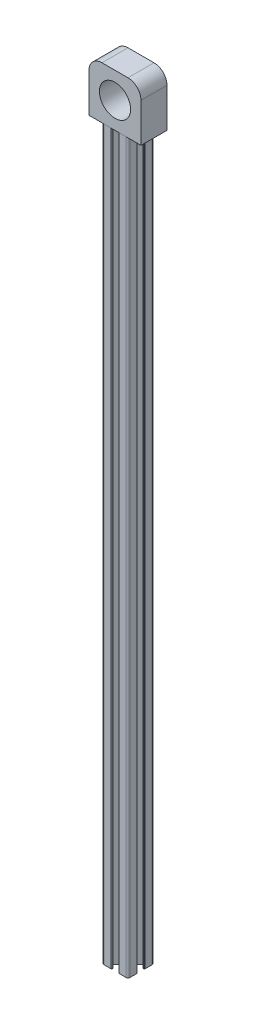
from build123d import *

# Parameters (mm, degrees)
BOSS_EXTRUDE1_DEPTH = 560
SKETCH2_W           = 40
SKETCH2_H           = 20
BOSS_EXTRUDE2_DEPTH = 40
FILLET1_R           = 10
SKETCH3_R           = 12
CUT_EXTRUDE1_DEPTH  = 40


with BuildPart() as part:
    # Sketch1 → Boss-Extrude1 (new body)
    with BuildSketch(Plane(origin=(0, 0, 0), x_dir=(1, 0, 0), z_dir=(0, 1, 0))):
        with BuildLine():
            Line((9.494919477, 2.658080263), (9.010919477, 2.658080263))
            ThreePointArc((9.010919477, 2.658080263), (8.651709233, 2.806870018), (8.502919477, 3.166080263))
            Line((8.502919477, 3.166080263), (8.502919477, 5.515080263))
            ThreePointArc((8.502919477, 5.515080263), (8.354129722, 5.874290508), (7.994919477, 6.023080263))
            Line((7.994919477, 6.023080263), (7.269000139, 6.023080263))
            ThreePointArc((7.269000139, 6.023080263), (7.074596955, 5.984411065), (6.909789894, 5.874290508))
            Line((6.909789894, 5.874290508), (3.806709233, 2.771209846))
            ThreePointArc((3.806709233, 2.771209846), (3.696588675, 2.606402785), (3.657919477, 2.411999602))
            Line((3.657919477, 2.411999602), (3.657919477, -2.355839076))
            ThreePointArc((3.657919477, -2.355839076), (3.696588675, -2.550242259), (3.806709233, -2.71504932))
            Line((3.806709233, -2.71504932), (6.909789894, -5.818129982))
            ThreePointArc((6.909789894, -5.818129982), (7.074596955, -5.92825054), (7.269000139, -5.966919737))
            Line((7.269000139, -5.966919737), (7.994919477, -5.966919737))
            ThreePointArc((7.994919477, -5.966919737), (8.354129722, -5.818129982), (8.502919477, -5.458919737))
            Line((8.502919477, -5.458919737), (8.502919477, -3.109919737))
            ThreePointArc((8.502919477, -3.109919737), (8.651709233, -2.750709492), (9.010919477, -2.601919737))
            Line((9.010919477, -2.601919737), (9.494919477, -2.601919737))
            ThreePointArc((9.494919477, -2.601919737), (9.854129722, -2.750709492), (10.002919477, -3.109919737))
            Line((10.002919477, -3.109919737), (10.002919477, -8.471919737))
            ThreePointArc((10.002919477, -8.471919737), (9.563579649, -9.532579909), (8.502919477, -9.971919737))
            Line((8.502919477, -9.971919737), (3.140919477, -9.971919737))
            ThreePointArc((3.140919477, -9.971919737), (2.781709233, -9.823129982), (2.632919477, -9.463919737))
            Line((2.632919477, -9.463919737), (2.632919477, -8.979919737))
            ThreePointArc((2.632919477, -8.979919737), (2.781709233, -8.620709492), (3.140919477, -8.471919737))
            Line((3.140919477, -8.471919737), (5.489919477, -8.471919737))
            ThreePointArc((5.489919477, -8.471919737), (5.849129722, -8.323129982), (5.997919477, -7.963919737))
            Line((5.997919477, -7.963919737), (5.997919477, -7.238000398))
            ThreePointArc((5.997919477, -7.238000398), (5.95925028, -7.043597215), (5.849129722, -6.878790154))
            Line((5.849129722, -6.878790154), (2.746049061, -3.775709492))
            ThreePointArc((2.746049061, -3.775709492), (2.581242, -3.665588935), (2.386838816, -3.626919737))
            Line((2.386838816, -3.626919737), (-2.380999861, -3.626919737))
            ThreePointArc((-2.380999861, -3.626919737), (-2.575403045, -3.665588935), (-2.740210106, -3.775709492))
            Line((-2.740210106, -3.775709492), (-5.843290767, -6.878790154))
            ThreePointArc((-5.843290767, -6.878790154), (-5.953411325, -7.043597215), (-5.992080523, -7.238000398))
            Line((-5.992080523, -7.238000398), (-5.992080523, -7.963919737))
            ThreePointArc((-5.992080523, -7.963919737), (-5.843290767, -8.323129982), (-5.484080523, -8.471919737))
            Line((-5.484080523, -8.471919737), (-3.135080523, -8.471919737))
            ThreePointArc((-3.135080523, -8.471919737), (-2.775870278, -8.620709492), (-2.627080523, -8.979919737))
            Line((-2.627080523, -8.979919737), (-2.627080523, -9.463919737))
            ThreePointArc((-2.627080523, -9.463919737), (-2.775870278, -9.823129982), (-3.135080523, -9.971919737))
            Line((-3.135080523, -9.971919737), (-8.497080523, -9.971919737))
            ThreePointArc((-8.497080523, -9.971919737), (-9.557740694, -9.532579909), (-9.997080523, -8.471919737))
            Line((-9.997080523, -8.471919737), (-9.997080523, -3.109919737))
            ThreePointArc((-9.997080523, -3.109919737), (-9.848290767, -2.750709492), (-9.489080523, -2.601919737))
            Line((-9.489080523, -2.601919737), (-9.005080523, -2.601919737))
            ThreePointArc((-9.005080523, -2.601919737), (-8.645870278, -2.750709492), (-8.497080523, -3.109919737))
            Line((-8.497080523, -3.109919737), (-8.497080523, -5.458919737))
            ThreePointArc((-8.497080523, -5.458919737), (-8.348290767, -5.818129982), (-7.989080523, -5.966919737))
            Line((-7.989080523, -5.966919737), (-7.263161184, -5.966919737))
            ThreePointArc((-7.263161184, -5.966919737), (-7.068758, -5.92825054), (-6.903950939, -5.818129982))
            Line((-6.903950939, -5.818129982), (-3.800870278, -2.71504932))
            ThreePointArc((-3.800870278, -2.71504932), (-3.69074972, -2.550242259), (-3.652080523, -2.355839076))
            Line((-3.652080523, -2.355839076), (-3.652080523, 2.411999602))
            ThreePointArc((-3.652080523, 2.411999602), (-3.69074972, 2.606402785), (-3.800870278, 2.771209846))
            Line((-3.800870278, 2.771209846), (-6.903950939, 5.874290508))
            ThreePointArc((-6.903950939, 5.874290508), (-7.068758, 5.984411065), (-7.263161184, 6.023080263))
            Line((-7.263161184, 6.023080263), (-7.989080523, 6.023080263))
            ThreePointArc((-7.989080523, 6.023080263), (-8.348290767, 5.874290508), (-8.497080523, 5.515080263))
            Line((-8.497080523, 5.515080263), (-8.497080523, 3.166080263))
            ThreePointArc((-8.497080523, 3.166080263), (-8.645870278, 2.806870018), (-9.005080523, 2.658080263))
            Line((-9.005080523, 2.658080263), (-9.489080523, 2.658080263))
            ThreePointArc((-9.489080523, 2.658080263), (-9.848290767, 2.806870018), (-9.997080523, 3.166080263))
            Line((-9.997080523, 3.166080263), (-9.997080523, 8.528080263))
            ThreePointArc((-9.997080523, 8.528080263), (-9.557740694, 9.588740435), (-8.497080523, 10.028080263))
            Line((-8.497080523, 10.028080263), (-3.135080523, 10.028080263))
            ThreePointArc((-3.135080523, 10.028080263), (-2.775870278, 9.879290508), (-2.627080523, 9.520080263))
            Line((-2.627080523, 9.520080263), (-2.627080523, 9.036080263))
            ThreePointArc((-2.627080523, 9.036080263), (-2.775870278, 8.676870018), (-3.135080523, 8.528080263))
            Line((-3.135080523, 8.528080263), (-5.484080523, 8.528080263))
            ThreePointArc((-5.484080523, 8.528080263), (-5.843290767, 8.379290508), (-5.992080523, 8.020080263))
            Line((-5.992080523, 8.020080263), (-5.992080523, 7.294160924))
            ThreePointArc((-5.992080523, 7.294160924), (-5.953411325, 7.099757741), (-5.843290767, 6.93495068))
            Line((-5.843290767, 6.93495068), (-2.740210106, 3.831870018))
            ThreePointArc((-2.740210106, 3.831870018), (-2.575403045, 3.72174946), (-2.380999861, 3.683080263))
            Line((-2.380999861, 3.683080263), (2.386838816, 3.683080263))
            ThreePointArc((2.386838816, 3.683080263), (2.581242, 3.72174946), (2.746049061, 3.831870018))
            Line((2.746049061, 3.831870018), (5.849129722, 6.93495068))
            ThreePointArc((5.849129722, 6.93495068), (5.95925028, 7.099757741), (5.997919477, 7.294160924))
            Line((5.997919477, 7.294160924), (5.997919477, 8.020080263))
            ThreePointArc((5.997919477, 8.020080263), (5.849129722, 8.379290508), (5.489919477, 8.528080263))
            Line((5.489919477, 8.528080263), (3.140919477, 8.528080263))
            ThreePointArc((3.140919477, 8.528080263), (2.781709233, 8.676870018), (2.632919477, 9.036080263))
            Line((2.632919477, 9.036080263), (2.632919477, 9.520080263))
            ThreePointArc((2.632919477, 9.520080263), (2.781709233, 9.879290508), (3.140919477, 10.028080263))
            Line((3.140919477, 10.028080263), (8.502919477, 10.028080263))
            ThreePointArc((8.502919477, 10.028080263), (9.563579649, 9.588740435), (10.002919477, 8.528080263))
            Line((10.002919477, 8.528080263), (10.002919477, 3.166080263))
            ThreePointArc((10.002919477, 3.166080263), (9.854129722, 2.806870018), (9.494919477, 2.658080263))
        make_face()
        with BuildLine():
            Line((2.127820321, -2.276425703), (2.307425444, -2.096820581))
            ThreePointArc((2.307425444, -2.096820581), (2.508857494, -1.328387548), (1.938052984, -0.775896455))
            ThreePointArc((1.938052984, -0.775896455), (2.098419477, 0.028080263), (1.938052984, 0.832056981))
            ThreePointArc((1.938052984, 0.832056981), (2.508857494, 1.384548074), (2.307425444, 2.152981107))
            Line((2.307425444, 2.152981107), (2.127820321, 2.332586229))
            ThreePointArc((2.127820321, 2.332586229), (1.359387288, 2.53401828), (0.806896195, 1.963213769))
            ThreePointArc((0.806896195, 1.963213769), (0.002919477, 2.123580263), (-0.801057241, 1.963213769))
            ThreePointArc((-0.801057241, 1.963213769), (-1.353548333, 2.53401828), (-2.121981366, 2.332586229))
            Line((-2.121981366, 2.332586229), (-2.301586489, 2.152981107))
            ThreePointArc((-2.301586489, 2.152981107), (-2.503018539, 1.384548074), (-1.932214029, 0.832056981))
            ThreePointArc((-1.932214029, 0.832056981), (-2.092580523, 0.028080263), (-1.932214029, -0.775896455))
            ThreePointArc((-1.932214029, -0.775896455), (-2.503018539, -1.328387548), (-2.301586489, -2.096820581))
            Line((-2.301586489, -2.096820581), (-2.121981366, -2.276425703))
            ThreePointArc((-2.121981366, -2.276425703), (-1.353548333, -2.477857754), (-0.801057241, -1.907053243))
            ThreePointArc((-0.801057241, -1.907053243), (0.002919477, -2.067419737), (0.806896195, -1.907053243))
            ThreePointArc((0.806896195, -1.907053243), (1.359387288, -2.477857754), (2.127820321, -2.276425703))
        make_face(mode=Mode.SUBTRACT)
    extrude(amount=BOSS_EXTRUDE1_DEPTH)

    # Sketch2 → Boss-Extrude2 (add)
    with BuildSketch(Plane(origin=(0, 560, 0), x_dir=(1, 0, 0), z_dir=(0, 1, 0))):
        Rectangle(SKETCH2_W, SKETCH2_H)
    extrude(amount=BOSS_EXTRUDE2_DEPTH)

    # Fillet1
    fillet1_edges = [part.edges().sort_by_distance(p)[0] for p in [
        (-20, 600, 0),
        (20, 600, 0),
    ]]
    fillet(fillet1_edges, radius=FILLET1_R)

    # Sketch3 → Cut-Extrude1 (cut)
    with BuildSketch(Plane.XY.offset(10)):
        with Locations((0, 580)):
            Circle(SKETCH3_R)
    extrude(amount=-CUT_EXTRUDE1_DEPTH, mode=Mode.SUBTRACT)


solid = part.part
